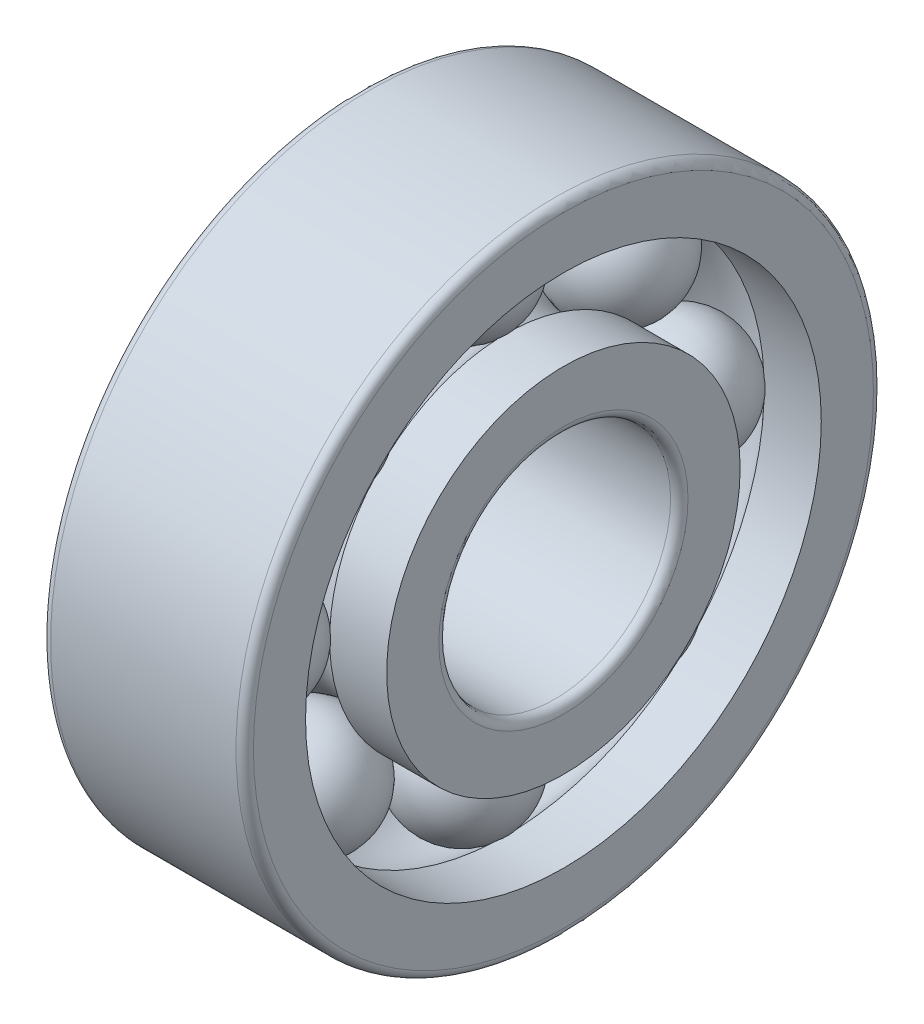
from build123d import *

# Parameters (mm, degrees)
CAGSPISKE_W         = 0.42
CAGSPISKE_H         = 0.7
CAGESPINE_ANGLE     = 0.001
BALLSDETAILED_COUNT = 8
BALLSDETAILED_ANGLE = 315


with BuildPart() as part:
    # CagSpiSke → CageSpine (revolve)
    with BuildSketch(Plane.XY):
        with Locations((0, 7.5)):
            Rectangle(CAGSPISKE_W, CAGSPISKE_H)
    revolve(axis=Axis((-20.6375, 0, 0), (-1, 0, 0)), revolution_arc=CAGESPINE_ANGLE)

    # BalDetSke → BallDetailed (revolve)
    with BuildSketch(Plane.XY):
        with BuildLine():
            Line((-2.1, 7.5), (2.1, 7.5))
            ThreePointArc((2.1, 7.5), (0, 5.4), (-2.1, 7.5))
        make_face()
    balldetailed = revolve(axis=Axis((-1.905, 7.5, 0), (1, 0, 0)))

    # InnRacSke → InnerRace (revolve)
    with BuildSketch(Plane.XY):
        with BuildLine():
            Line((-1.531543339, 6.1), (-3.5, 6.1))
            Line((-3.5, 6.1), (-3.5, 4.3))
            ThreePointArc((-3.5, 4.3), (-3.412132034, 4.087867966), (-3.2, 4))
            Line((-3.2, 4), (3.2, 4))
            ThreePointArc((3.2, 4), (3.412132034, 4.087867966), (3.5, 4.3))
            Line((3.5, 4.3), (3.5, 6.1))
            Line((3.5, 6.1), (1.531543339, 6.1))
            ThreePointArc((1.531543339, 6.1), (0, 5.425), (-1.531543339, 6.1))
        make_face()
    revolve(axis=Axis((-20.6375, 0, 0), (1, 0, 0)))

    # OutRacSke → OuterRace (revolve)
    with BuildSketch(Plane.XY):
        with BuildLine():
            Line((-1.531543339, 8.9), (-3.5, 8.9))
            Line((-3.5, 8.9), (-3.5, 10.7))
            ThreePointArc((-3.5, 10.7), (-3.412132034, 10.912132034), (-3.2, 11))
            Line((-3.2, 11), (3.2, 11))
            ThreePointArc((3.2, 11), (3.412132034, 10.912132034), (3.5, 10.7))
            Line((3.5, 10.7), (3.5, 8.9))
            Line((3.5, 8.9), (1.531543339, 8.9))
            ThreePointArc((1.531543339, 8.9), (0, 9.575), (-1.531543339, 8.9))
        make_face()
    revolve(axis=Axis((-20.6375, 0, 0), (1, 0, 0)))

    # BallsDetailed: BallDetailed ×8 about axis
    ballsdetailed_axis = Axis((-50, 0, 0), (1, 0, 0))
    for i in range(1, BALLSDETAILED_COUNT):
        add(balldetailed.rotate(ballsdetailed_axis, i * BALLSDETAILED_ANGLE / (BALLSDETAILED_COUNT - 1)))


solid = part.part
